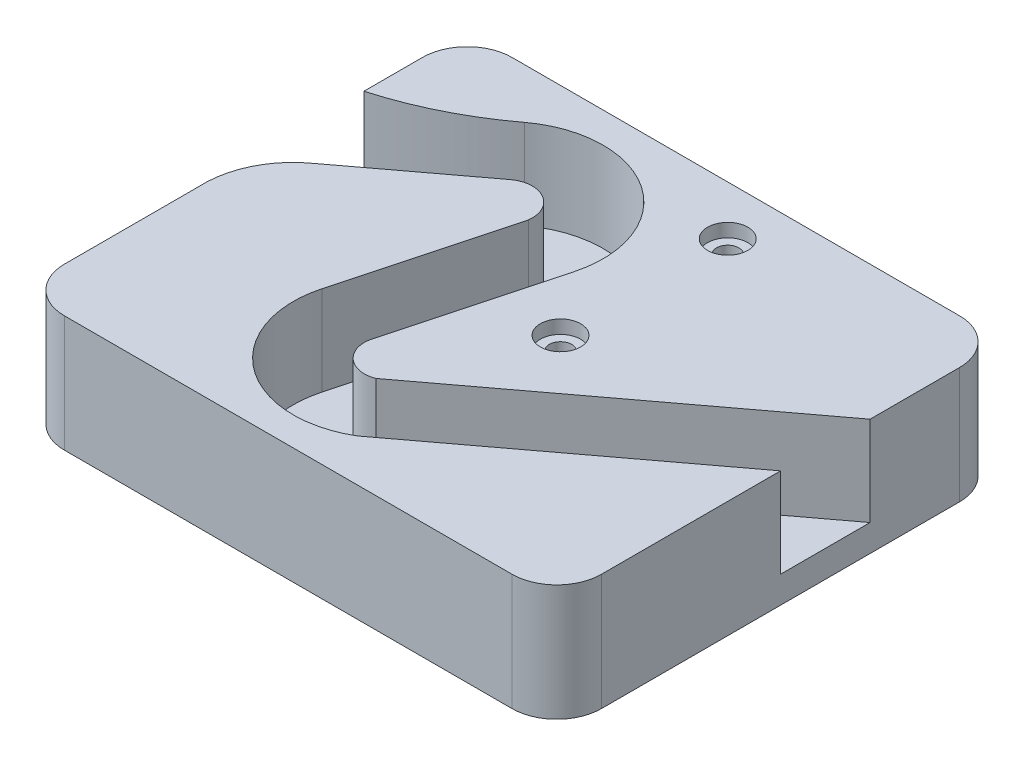
from build123d import *

# Parameters (mm, degrees)
BOSS_EXTRUDE1_DEPTH = 33.02
CUT_EXTRUDE1_DEPTH  = 25.4
SKETCH3_R           = 3.175
CUT_EXTRUDE2_DEPTH  = 113.70847528
SKETCH4_R           = 5.715
SKETCH4_R_2         = 3.175
CUT_EXTRUDE3_DEPTH  = 3.81
SHELL4_DEPTH        = 17.78
SHELL4_2_DEPTH      = 13.97


# Read off the part's stored shape, not the designer's step: Shell4
with BuildPart() as part:
    # Sketch1 → Boss-Extrude1 (new body)
    with BuildSketch(Plane(origin=(0, 0, 0), x_dir=(1, 0, 0), z_dir=(0, 1, 0))):
        with BuildLine():
            Line((-63.5, -76.2), (63.5, -76.2))
            ThreePointArc((63.5, -76.2), (72.480256121, -72.480256121), (76.2, -63.5))
            Line((76.2, -63.5), (76.2, 38.1))
            ThreePointArc((76.2, 38.1), (72.480256121, 47.080256121), (63.5, 50.8))
            Line((63.5, 50.8), (-63.5, 50.8))
            ThreePointArc((-63.5, 50.8), (-72.480256121, 47.080256121), (-76.2, 38.1))
            Line((-76.2, 38.1), (-76.2, -63.5))
            ThreePointArc((-76.2, -63.5), (-72.480256121, -72.480256121), (-63.5, -76.2))
        make_face()
    extrude(amount=BOSS_EXTRUDE1_DEPTH)

    # Sketch2 → Cut-Extrude1 (cut)
    with BuildSketch(Plane(origin=(0, 33.02, 0), x_dir=(1, 0, 0), z_dir=(0, 1, 0))):
        with BuildLine():
            Line((-21.234187682, 13.253251383), (-33.621595815, -32.977185142))
            ThreePointArc((-33.621595815, -32.977185142), (-23.484698626, -62.452913285), (7.640823288, -64.119382534))
            Line((7.640823288, -64.119382534), (76.2, -12.7))
            Line((76.2, -12.7), (76.2, 12.7))
            Line((76.2, 12.7), (-3.941576712, -47.406182534))
            ThreePointArc((-3.941576712, -47.406182534), (-11.856979187, -45.921156496), (-14.138642435, -38.197626766))
            Line((-14.138642435, -38.197626766), (-2.029571171, 6.994042425))
            ThreePointArc((-2.029571171, 6.994042425), (-13.371601822, 37.382259223), (-45.797751473, 36.588408962))
            ThreePointArc((-45.797751473, 36.588408962), (-60.308353779, 27.645114035), (-76.2, 21.481050133))
            Line((-76.2, 21.481050133), (-76.2, -23.043277433))
            ThreePointArc((-76.2, -23.043277433), (-73.166835121, -11.965986434), (-65.564641264, -3.357089081))
            Line((-65.564641264, -3.357089081), (-33.739992737, 20.511397314))
            ThreePointArc((-33.739992737, 20.511397314), (-25.085058678, 21.02103117), (-21.234187682, 13.253251383))
        make_face()
    extrude(amount=-CUT_EXTRUDE1_DEPTH, mode=Mode.SUBTRACT)

    # Sketch3 → Cut-Extrude2 (cut, through all)
    with BuildSketch(Plane(origin=(0, 33.02, 0), x_dir=(1, 0, 0), z_dir=(0, 1, 0))):
        with Locations(Location((11.674814186, 36.83, 0), (0, 0, 270))):
            Circle(SKETCH3_R)
        with Locations(Location((11.674814186, -10.616391667, 0), (0, 0, 270))):
            Circle(SKETCH3_R)
    extrude(amount=-CUT_EXTRUDE2_DEPTH, mode=Mode.SUBTRACT)

    # Sketch4 → Cut-Extrude3 (cut)
    # profile 1 of 2: a face of its own
    with BuildSketch(Plane(origin=(0, 33.02, 0), x_dir=(1, 0, 0), z_dir=(0, 1, 0))):
        with Locations(Location((11.674814186, 36.83, 0), (0, 0, 270))):
            Circle(SKETCH4_R)
    # profile 2 of 2: a face of its own
    with BuildSketch(Plane(origin=(0, 33.02, 0), x_dir=(1, 0, 0), z_dir=(0, 1, 0))):
        with Locations(Location((11.674814186, -10.616391667, 0), (0, 0, 270))):
            Circle(SKETCH4_R)
        with Locations(Location((11.674814186, -10.616391667, 0), (0, 0, 270))):
            Circle(SKETCH4_R_2, mode=Mode.SUBTRACT)
    extrude(amount=-CUT_EXTRUDE3_DEPTH, mode=Mode.SUBTRACT)

    # Shell4 outline → Shell4 (cut)
    with BuildSketch(Plane(origin=(0, 0, 0), x_dir=(1, 0, 0), z_dir=(0, 1, 0))):
        with BuildLine():
            Line((-41.788947679, -4.575318892), (-56.600935015, -15.684309395))
            ThreePointArc((-56.600935015, -15.684309395), (-59.668026883, -19.046046541), (-60.96, -23.409432225))
            Line((-60.96, -23.409432225), (-60.96, -60.96))
            Line((-60.96, -60.96), (-44.483340176, -60.96))
            ThreePointArc((-44.483340176, -60.96), (-49.500189899, -45.369554015), (-48.342305407, -29.032782895))
            Line((-48.342305407, -29.032782895), (-41.788947679, -4.575318892))
        make_face()
        Polygon((37.253333333, -60.96), (60.96, -60.96), (60.96, -43.18), align=None)
        with BuildLine():
            ThreePointArc((13.975676971, 10.211907722), (24.100715908, 6.256930217), (30.882136703, -2.238397473))
            Line((30.882136703, -2.238397473), (60.96, 20.32))
            Line((60.96, 20.32), (60.96, 35.56))
            Line((60.96, 35.56), (32.591293933, 35.56))
            ThreePointArc((32.591293933, 35.56), (26.905461548, 22.437661554), (14.125676613, 16.018817949))
            ThreePointArc((14.125676613, 16.018817949), (14.148411798, 13.11283822), (13.975676971, 10.211907722))
        make_face()
    extrude(amount=SHELL4_DEPTH, mode=Mode.SUBTRACT)

    # Shell4 2 outline → Shell4 2 (cut)
    with BuildSketch(Plane(origin=(0, 0, 0), x_dir=(1, 0, 0), z_dir=(0, 1, 0))):
        with BuildLine():
            Line((28.785986128, -3.810510404), (30.882136703, -2.238397473))
            ThreePointArc((30.882136703, -2.238397473), (24.100715908, 6.256930217), (13.975676971, 10.211907722))
            ThreePointArc((13.975676971, 10.211907722), (13.838972267, 8.949034749), (13.66518896, 7.690728075))
            ThreePointArc((13.66518896, 7.690728075), (22.823217362, 4.040529279), (28.785986128, -3.810510404))
        make_face()
        with BuildLine():
            ThreePointArc((13.945477939, 18.555528431), (14.054251914, 17.288499768), (14.125676613, 16.018817949))
            ThreePointArc((14.125676613, 16.018817949), (26.905461548, 22.437661554), (32.591293933, 35.56))
            Line((32.591293933, 35.56), (30.045968886, 35.56))
            ThreePointArc((30.045968886, 35.56), (25.046769189, 24.168916144), (13.945477939, 18.555528431))
        make_face()
    extrude(amount=SHELL4_2_DEPTH, mode=Mode.SUBTRACT)


solid = part.part
